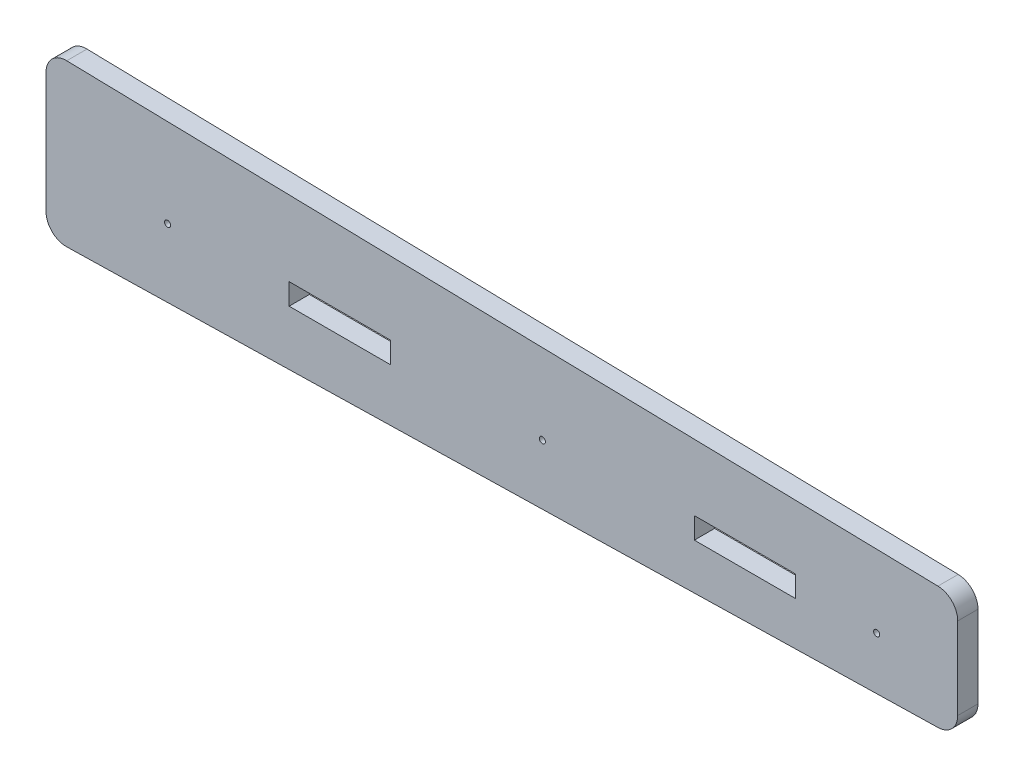
from build123d import *

# Parameters (mm, degrees)
SKETCH1_W              = 50
SKETCH1_H              = 10.5
EXTRUDE_503_DEPTH      = 10
FILLET1_R              = 10
CUT_EXTRUDE_1110_REACH = 230.707
SKETCH2_R              = 1.5


with BuildPart() as part:
    # Sketch1 → Extrude 503 (new body)
    with BuildSketch(Plane.XY):
        Polygon((-225, 40), (-225, -40), (225, -30), (225, 30), align=None)
        with Locations((-80, -5)):
            Rectangle(SKETCH1_W, SKETCH1_H, mode=Mode.SUBTRACT)
        with Locations((120, -5)):
            Rectangle(SKETCH1_W, SKETCH1_H, mode=Mode.SUBTRACT)
    extrude(amount=EXTRUDE_503_DEPTH)

    # Fillet1
    fillet1_edges = [part.edges().sort_by_distance(p)[0] for p in [
        (-225, -40, 5),
        (-225, 40, 5),
        (225, -30, 5),
        (225, 30, 5),
    ]]
    fillet(fillet1_edges, radius=FILLET1_R)

    # Sketch2 → Cut-Extrude 1110 (cut, up to next)
    with BuildSketch(Plane.XY.offset(10), mode=Mode.PRIVATE) as cut_extrude_1110_sk1:
        with Locations((-165, -5)):
            Circle(SKETCH2_R)
    cut_extrude_1110_tool1 = extrude(cut_extrude_1110_sk1.sketch, amount=-CUT_EXTRUDE_1110_REACH, mode=Mode.PRIVATE) & part.part
    # Sketch2 → Cut-Extrude 1110 (cut, up to next)
    with BuildSketch(Plane.XY.offset(10), mode=Mode.PRIVATE) as cut_extrude_1110_sk2:
        with Locations((20, -5)):
            Circle(SKETCH2_R)
    cut_extrude_1110_tool2 = extrude(cut_extrude_1110_sk2.sketch, amount=-CUT_EXTRUDE_1110_REACH, mode=Mode.PRIVATE) & part.part
    # Sketch2 → Cut-Extrude 1110 (cut, up to next)
    with BuildSketch(Plane.XY.offset(10), mode=Mode.PRIVATE) as cut_extrude_1110_sk3:
        with Locations((185, -5)):
            Circle(SKETCH2_R)
    cut_extrude_1110_tool3 = extrude(cut_extrude_1110_sk3.sketch, amount=-CUT_EXTRUDE_1110_REACH, mode=Mode.PRIVATE) & part.part
    add(cut_extrude_1110_tool1.solids().sort_by_distance((-165, -5, 10))[0], mode=Mode.SUBTRACT)
    add(cut_extrude_1110_tool2.solids().sort_by_distance((20, -5, 10))[0], mode=Mode.SUBTRACT)
    add(cut_extrude_1110_tool3.solids().sort_by_distance((185, -5, 10))[0], mode=Mode.SUBTRACT)


solid = part.part
